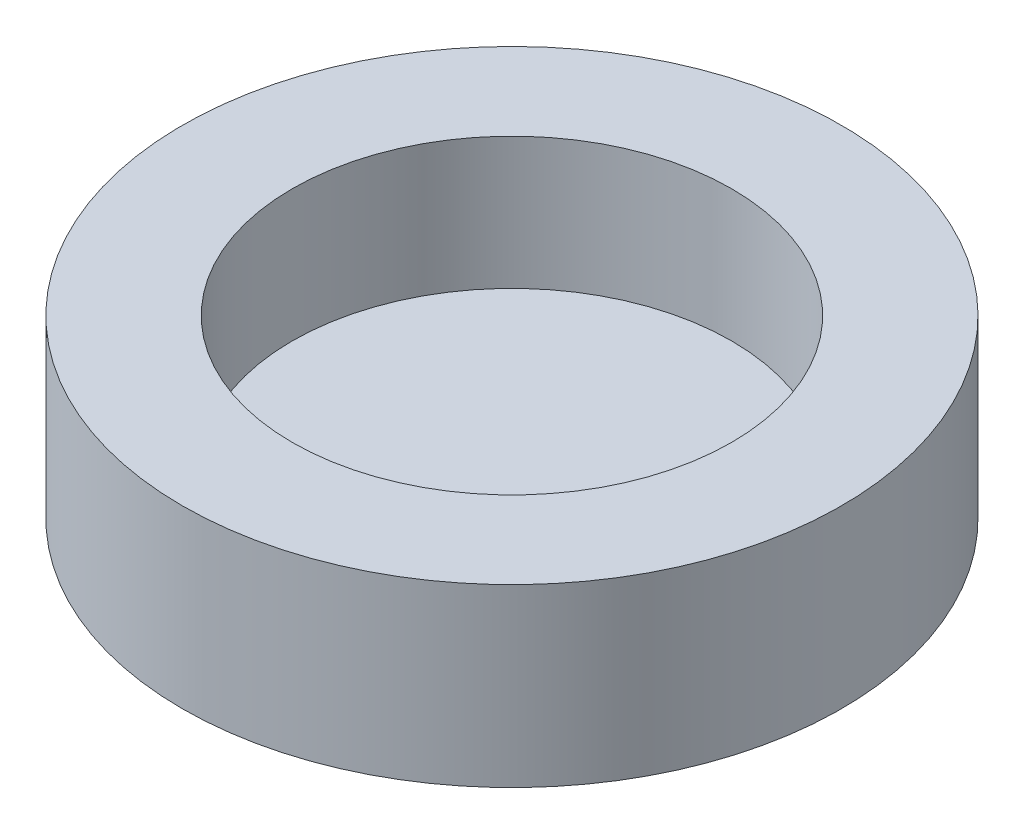
from build123d import *

# Parameters (mm, degrees)
SKETCH1_R           = 7.5
BOSS_EXTRUDE1_DEPTH = 4
SKETCH2_R           = 5
CUT_EXTRUDE1_DEPTH  = 3


with BuildPart() as part:
    # Sketch1 → Boss-Extrude1 (new body)
    with BuildSketch(Plane(origin=(0, 0, 0), x_dir=(1, 0, 0), z_dir=(0, 1, 0))):
        Circle(SKETCH1_R)
    extrude(amount=BOSS_EXTRUDE1_DEPTH)

    # Sketch2 → Cut-Extrude1 (cut)
    with BuildSketch(Plane(origin=(0, 4, 0), x_dir=(1, 0, 0), z_dir=(0, 1, 0))):
        Circle(SKETCH2_R)
    extrude(amount=-CUT_EXTRUDE1_DEPTH, mode=Mode.SUBTRACT)


solid = part.part
